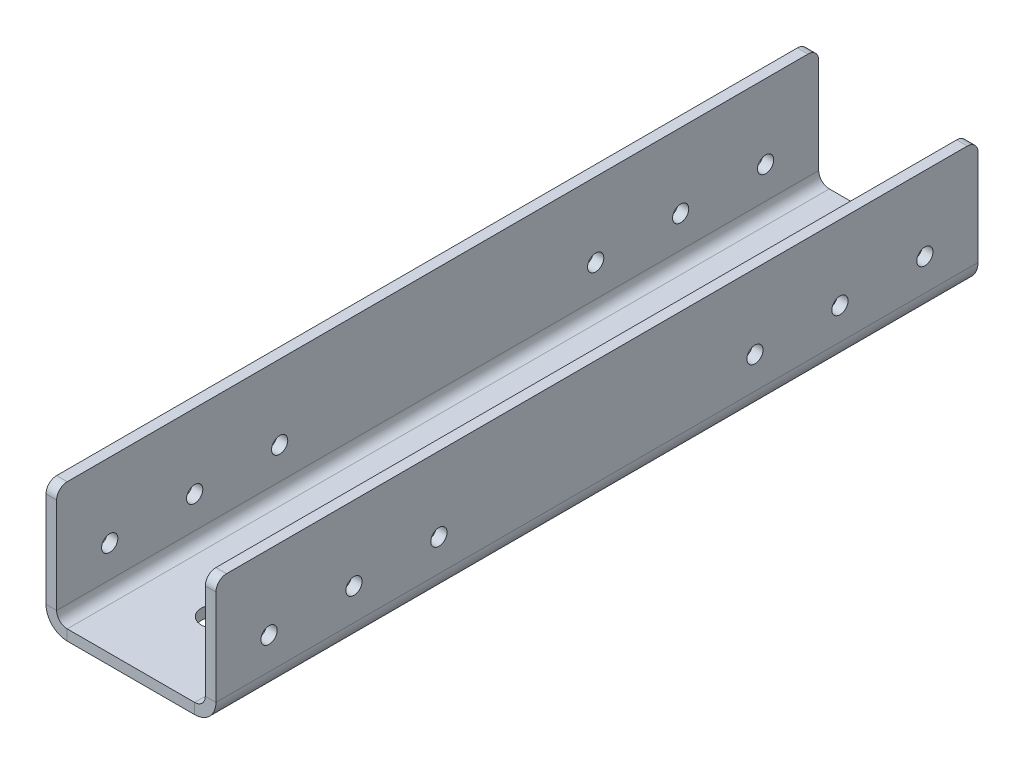
from build123d import *

# Parameters (mm, degrees)
BASE_FLANGE1_DEPTH = 227.838
SKETCH6_R          = 2.4257
CUT_EXTRUDE1_DEPTH = 237.521466772
SKETCH7_R          = 4.3688
CUT_EXTRUDE2_DEPTH = 237.521466772
FILLET1_R          = 3.175


# Sheet-metal steps are written as plain solids
with BuildPart() as part:
    # Sketch1 → Base-Flange1 (new body)
    with BuildSketch(Plane.XY):
        with BuildLine():
            Line((50.8, 38.1), (50.8, 6.35))
            ThreePointArc((50.8, 6.35), (48.940128061, 1.859871939), (44.45, 0))
            Line((44.45, 0), (6.35, 0))
            ThreePointArc((6.35, 0), (1.859871939, 1.859871939), (0, 6.35))
            Line((0, 6.35), (0, 38.1))
            Line((0, 38.1), (3.175, 38.1))
            Line((3.175, 38.1), (3.175, 6.35))
            ThreePointArc((3.175, 6.35), (4.10493597, 4.10493597), (6.35, 3.175))
            Line((6.35, 3.175), (44.45, 3.175))
            ThreePointArc((44.45, 3.175), (46.69506403, 4.10493597), (47.625, 6.35))
            Line((47.625, 6.35), (47.625, 38.1))
            Line((47.625, 38.1), (50.8, 38.1))
        make_face()
    extrude(amount=BASE_FLANGE1_DEPTH)

    # Sketch6 → Cut-Extrude1 (cut, through all)
    with BuildSketch(Plane(origin=(50.8, 0, 0), x_dir=(0, 0, -1), z_dir=(1, 0, 0))):
        with Locations((-15.875, 15.875)):
            Circle(SKETCH6_R)
        with Locations((-41.275, 15.875)):
            Circle(SKETCH6_R)
        with Locations((-66.675, 15.875)):
            Circle(SKETCH6_R)
        with Locations((-161.163, 15.875)):
            Circle(SKETCH6_R)
        with Locations((-186.563, 15.875)):
            Circle(SKETCH6_R)
        with Locations((-211.963, 15.875)):
            Circle(SKETCH6_R)
    extrude(amount=-CUT_EXTRUDE1_DEPTH, mode=Mode.SUBTRACT)

    # Sketch7 → Cut-Extrude2 (cut, through all)
    with BuildSketch(Plane.XZ):
        with Locations(Location((25.4, 25.4, 0), (0, 0, 270))):
            Circle(SKETCH7_R)
        with Locations(Location((25.4, 202.438, 0), (0, 0, 270))):
            Circle(SKETCH7_R)
    extrude(amount=-CUT_EXTRUDE2_DEPTH, mode=Mode.SUBTRACT)

    # Fillet1
    fillet1_edges = [part.edges().sort_by_distance(p)[0] for p in [
        (1.5875, 38.1, 0),
        (49.2125, 38.1, 0),
        (1.5875, 38.1, 227.838),
        (49.2125, 38.1, 227.838),
    ]]
    fillet(fillet1_edges, radius=FILLET1_R)


solid = part.part
